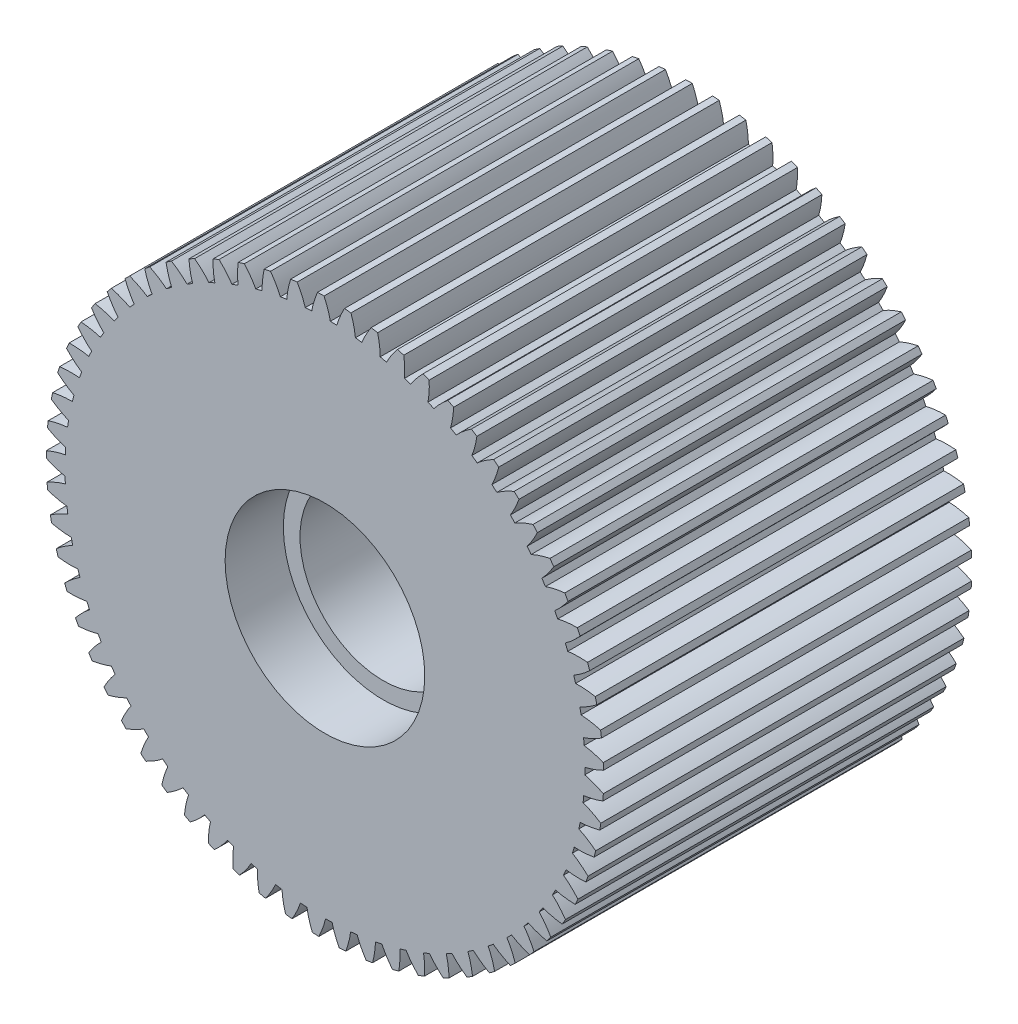
from build123d import *

# Parameters (mm, degrees)
SKETCH1_R           = 16.75
BOSS_EXTRUDE1_DEPTH = 11.06739905
CUT_EXTRUDE1_DEPTH  = 27.145980986
CIRPATTERN2_COUNT   = 65
SKETCH3_R           = 6
CUT_EXTRUDE2_DEPTH  = 3.5
SKETCH4_R           = 5
CUT_EXTRUDE3_DEPTH  = 31.139309607


with BuildPart() as part:
    # Sketch1 → Boss-Extrude1 (new, symmetric)
    with BuildSketch(Plane.XY):
        Circle(SKETCH1_R)
    extrude(amount=BOSS_EXTRUDE1_DEPTH, both=True)

    # Sketch2 → Cut-Extrude1 (cut, symmetric)
    with BuildSketch(Plane.XY):
        with BuildLine():
            ThreePointArc((15.624914533, 0.051680175), (15.624978633, 0.025840123), (15.625, 0))
            ThreePointArc((15.625, 0), (15.624329854, -0.144712205), (15.622319472, -0.289411996))
            ThreePointArc((15.622319472, -0.289411996), (15.621819489, -0.31524729), (15.621276781, -0.341081722))
            add(Edge.make_bspline(
                [(15.621276781, -0.341081722), (15.64676822, -0.347195071), (15.697965892, -0.360045697), (15.774553558, -0.380894314), (15.875977681, -0.411392788), (15.977013606, -0.44449941), (16.077203927, -0.479801219), (16.197981532, -0.525294884), (16.341963608, -0.583637138), (16.493847838, -0.650667055), (16.619204437, -0.710273594), (16.699662597, -0.750374713), (16.732429805, -0.767002495)],
                knots=[0.09247451, 0.09247451, 0.09247451, 0.09247451, 0.09247451, 0.119476176, 0.146842496, 0.174208854, 0.201574956, 0.228941013, 0.256307345, 0.307035032, 0.361767352, 0.399574627, 0.399574627, 0.399574627, 0.399574627, 0.399574627], degree=4))
            ThreePointArc((16.732429805, -0.767002495), (16.745606875, -0.383601857), (16.75, 0))
            ThreePointArc((16.75, 0), (16.748441426, 0.228494609), (16.743765996, 0.456946695))
            add(Edge.make_bspline(
                [(15.624914533, 0.051680175), (15.650514833, 0.057320314), (15.701941746, 0.069220433), (15.778902439, 0.088646888), (15.880874066, 0.117261516), (15.982505871, 0.148491033), (16.083332877, 0.181931024), (16.204932413, 0.225179797), (16.349970424, 0.280845154), (16.503070151, 0.345050316), (16.629509299, 0.402324728), (16.710696424, 0.440928692), (16.743765996, 0.456946695)],
                knots=[0.09247451, 0.09247451, 0.09247451, 0.09247451, 0.09247451, 0.119476176, 0.146842496, 0.174208854, 0.201574956, 0.228941013, 0.256307345, 0.307035032, 0.361767352, 0.399574627, 0.399574627, 0.399574627, 0.399574627, 0.399574627], degree=4))
        make_face()
    cut_extrude1 = extrude(amount=CUT_EXTRUDE1_DEPTH, both=True, mode=Mode.SUBTRACT)

    # CirPattern2: Cut-Extrude1 ×65 about axis
    cirpattern2_axis = Axis((0, 0, 11.06739905), (0, 0, -1))
    for i in range(1, CIRPATTERN2_COUNT):
        add(cut_extrude1.rotate(cirpattern2_axis, i * 360 / CIRPATTERN2_COUNT), mode=Mode.SUBTRACT)

    # Sketch3 → Cut-Extrude2 (cut)
    with BuildSketch(Plane.XY.offset(11.06739905)):
        Circle(SKETCH3_R)
    cut_extrude2 = extrude(amount=-CUT_EXTRUDE2_DEPTH, mode=Mode.SUBTRACT)

    # Sketch4 → Cut-Extrude3 (cut, through all)
    with BuildSketch(Plane.XY.offset(7.56739905)):
        Circle(SKETCH4_R)
    extrude(amount=-CUT_EXTRUDE3_DEPTH, mode=Mode.SUBTRACT)

    # Mirror1: Cut-Extrude2 across plane
    add(cut_extrude2.mirror(Plane.XY), mode=Mode.SUBTRACT)


solid = part.part
